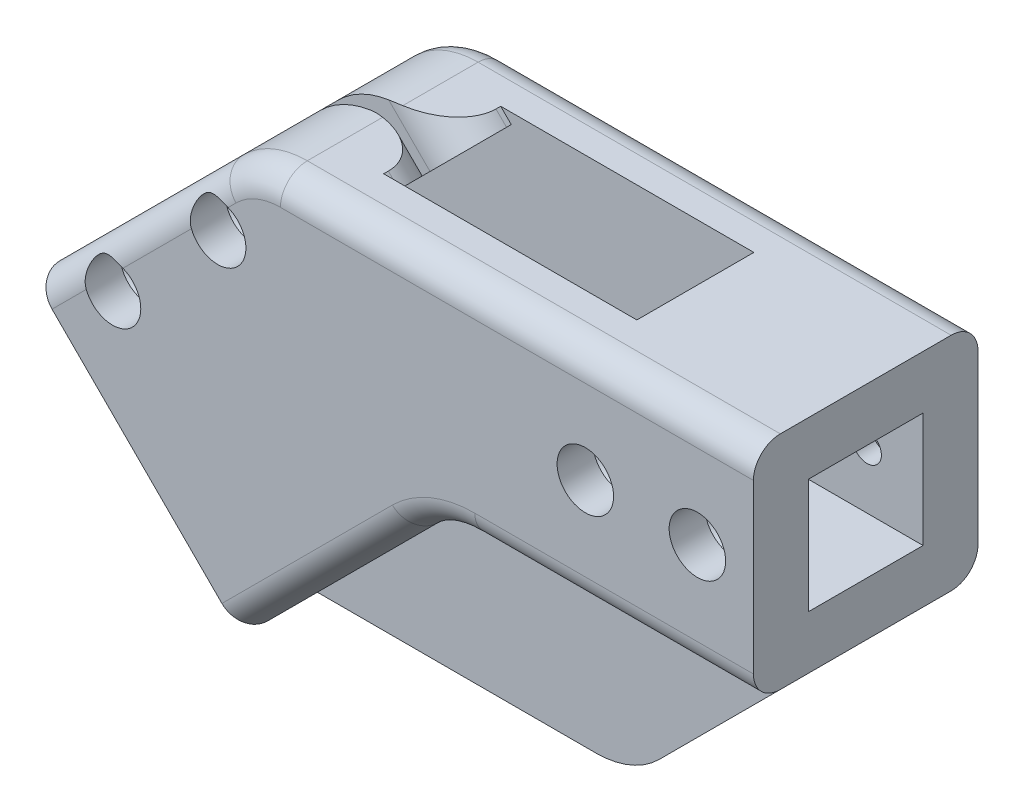
from build123d import *

# Parameters (mm, degrees)
BOSS_EXTRUDE1_DEPTH                            = 6.525
BOSS_EXTRUDE1_2_DEPTH                          = 6.525
BOSS_EXTRUDE1_3_DEPTH                          = 6.525
BOSS_EXTRUDE2_START                            = 6.525
BOSS_EXTRUDE2_DEPTH                            = 6
BOSS_EXTRUDE3_DEPTH                            = 4
FILLET1_R                                      = 10
FILLET2_R                                      = 3
CUT_EXTRUDE1_DEPTH                             = 1
CSK_FOR_M3_FLAT_HEAD_MACHINE_SCREW1_AT_2_COUNT = 2
CSK_FOR_M3_FLAT_HEAD_MACHINE_SCREW1_AT_2_PITCH = 16.585281374
CSK_FOR_M3_FLAT_HEAD_MACHINE_SCREW1_AT_3_COUNT = 2
CSK_FOR_M3_FLAT_HEAD_MACHINE_SCREW1_AT_3_PITCH = 41.156976568
CSK_FOR_M3_FLAT_HEAD_MACHINE_SCREW1_AT_4_COUNT = 2
CSK_FOR_M3_FLAT_HEAD_MACHINE_SCREW1_AT_4_PITCH = 53.622609719
CUT_EXTRUDE2_DEPTH                             = 4
FILLET3_R                                      = 5
MOVE_START                                     = -6.525
MOVE_FACE2_OUTLINE_R                           = 1.6
MOVE_FACE2_DEPTH                               = 0.125
MOVE_START_2                                   = 6.4
MOVE_FACE2_2_OUTLINE_R                         = 1.6
MOVE_FACE2_2_DEPTH                             = 0.125
MOVE_START_3                                   = -0.05
MOVE_FACE3_OUTLINE_W                           = 37.75
MOVE_FACE3_OUTLINE_H                           = 12.8
MOVE_FACE3_DEPTH                               = 12.8


with BuildPart() as part:
    # Sketch1 → Boss-Extrude1 (new body)
    with BuildSketch(Plane.XY):
        Polygon((25, 0), (-12.7, 0), (-36.405591591, -23.705591591), (-32.162950904, -27.948232278), (-10.214718626, -6), (25, -6), align=None)
    boss_extrude1 = extrude(amount=BOSS_EXTRUDE1_DEPTH)



with BuildPart() as body_2:
    # Sketch1 → Boss-Extrude1 2 (new body)
    with BuildSketch(Plane.XY):
        Polygon((-49.345645687, -10.765537495), (-21.061374439, 17.518733752), (-22.242640687, 18.7), (-31.900923472, 18.7), (-55.356053327, -4.755129855), align=None)
    boss_extrude1_2 = extrude(amount=BOSS_EXTRUDE1_2_DEPTH)


with BuildPart() as body_3:
    # Sketch1 → Boss-Extrude1 3 (new body)
    with BuildSketch(Plane.XY):
        Polygon((6, 18.7), (0, 12.7), (25, 12.7), (25, 18.7), align=None)
    boss_extrude1_3 = extrude(amount=BOSS_EXTRUDE1_3_DEPTH)


with BuildPart() as part_1:
    add(part.part)

    add(body_2.part)  # Boss-Extrude2 merges body 2

    add(body_3.part)  # Boss-Extrude2 merges body 3
    # Sketch1<3> → Boss-Extrude2 (add)
    with BuildSketch(Plane.XY.offset(BOSS_EXTRUDE2_START)):
        Polygon((-32.162950904, -27.948232278), (-10.214718626, -6), (25, -6), (25, 18.7), (-31.900923472, 18.7), (-55.356053327, -4.755129855), align=None)
    boss_extrude2 = extrude(amount=BOSS_EXTRUDE2_DEPTH)

    # Mirror2: Boss-Extrude1, Boss-Extrude1 2, Boss-Extrude1 3, Boss-Extrude2 across plane
    add(boss_extrude1.mirror(Plane.XY))
    add(boss_extrude1_2.mirror(Plane.XY))
    add(boss_extrude1_3.mirror(Plane.XY))
    add(boss_extrude2.mirror(Plane.XY))

    # Sketch2 → Boss-Extrude3 (add, symmetric)
    with BuildSketch(Plane.XY):
        Polygon((-32.162950904, -27.948232278), (3.051767722, -27.948232278), (25, -6), (-10.214718626, -6), align=None)
    extrude(amount=BOSS_EXTRUDE3_DEPTH, both=True)

    # Fillet1
    fillet1_edges = [part_1.edges().sort_by_distance(p)[0] for p in [
        (-31.900923472, 18.7, 0),
        (-10.214718626, -6, 8.2625),
        (-10.214718626, -6, -8.2625),
        (3.051767722, -27.948232278, 0),
    ]]
    fillet(fillet1_edges, radius=FILLET1_R)

    # Fillet2
    fillet2_edges = [part_1.edges().sort_by_distance(p)[0] for p in [
        (-22.653300859, -18.438582233, -12.525),
        (-22.653300859, -18.438582233, 12.525),
        (-45.092954493, 5.507968978, -12.525),
        (-45.092954493, 5.507968978, 12.525),
        (-31.585622172, 17.938795325, -12.525),
        (-31.585622172, 17.938795325, 12.525),
        (-9.899417326, -6.761204675, -12.525),
        (-9.899417326, -6.761204675, 12.525),
        (9.463708499, -6, 12.525),
        (-1.379393924, 18.7, 12.525),
        (-1.379393924, 18.7, -12.525),
        (9.463708499, -6, -12.525),
    ]]
    fillet(fillet2_edges, radius=FILLET2_R)

    # Sketch1<4> → Cut-Extrude1 (cut, symmetric)
    with BuildSketch(Plane.XY):
        Polygon((-49.345645687, -10.765537495), (-21.061374439, 17.518733752), (-22.242640687, 18.7), (-31.900923472, 18.7), (-55.356053327, -4.755129855), align=None)
    extrude(amount=CUT_EXTRUDE1_DEPTH, both=True, mode=Mode.SUBTRACT)

    # Sketch6 → CSK for M3 Flat Head Machine Screw1 (revolve, cut)
    with BuildSketch(Plane(origin=(-34.759502115, 9.831013716, 12.525), x_dir=(0, -1, 0), z_dir=(1, 0, 0))):
        Polygon((0, 0), (0, 25.05), (1.6, 25.05), (1.6, 5.55), (3.15, 4), (3.15, 0), align=None)
    csk_for_m3_flat_head_machine_screw1 = revolve(axis=Axis((-34.759502115, 9.831013716, 18.875), (0, 0, -1)), mode=Mode.SUBTRACT)

    # CSK for M3 Flat Head Machine Screw1 at 2: CSK for M3 Flat Head Machine Screw1 ×2
    with Locations(*[Vector(-0.7071067811865509, -0.7071067811865441, 0) * (i * CSK_FOR_M3_FLAT_HEAD_MACHINE_SCREW1_AT_2_PITCH) for i in range(1, CSK_FOR_M3_FLAT_HEAD_MACHINE_SCREW1_AT_2_COUNT)]):
        add(csk_for_m3_flat_head_machine_screw1, mode=Mode.SUBTRACT)

    # CSK for M3 Flat Head Machine Screw1 at 3: CSK for M3 Flat Head Machine Screw1 ×2
    with Locations(*[Vector(0.9964167811823362, -0.08457894642422821, 0) * (i * CSK_FOR_M3_FLAT_HEAD_MACHINE_SCREW1_AT_3_PITCH) for i in range(1, CSK_FOR_M3_FLAT_HEAD_MACHINE_SCREW1_AT_3_COUNT)]):
        add(csk_for_m3_flat_head_machine_screw1, mode=Mode.SUBTRACT)

    # CSK for M3 Flat Head Machine Screw1 at 4: CSK for M3 Flat Head Machine Screw1 ×2
    with Locations(*[Vector(0.9978906732683498, -0.06491690229855007, 0) * (i * CSK_FOR_M3_FLAT_HEAD_MACHINE_SCREW1_AT_4_PITCH) for i in range(1, CSK_FOR_M3_FLAT_HEAD_MACHINE_SCREW1_AT_4_COUNT)]):
        add(csk_for_m3_flat_head_machine_screw1, mode=Mode.SUBTRACT)

    # Sketch7 → Cut-Extrude2 (cut)
    with BuildSketch(Plane(origin=(0, 0, -12.525), x_dir=(-1, 0, 0), z_dir=(0, 0, -1))):
        Polygon((37.93826407, 10.682760415), (35.611248814, 13.00977567), (32.43248686, 12.158028972), (31.580740161, 8.979267018), (33.907755417, 6.652251762), (37.086517371, 7.503998461), align=None)
        Polygon((49.665828997, -1.044804513), (47.338813742, 1.282210743), (44.160051787, 0.430464044), (43.308305089, -2.74829791), (45.635320344, -5.075313166), (48.814082299, -4.223566467), align=None)
        Polygon((-15.459103466, 6.35), (-17.104551733, 9.2), (-20.395448267, 9.2), (-22.040896534, 6.35), (-20.395448267, 3.5), (-17.104551733, 3.5), align=None)
        Polygon((-2.959103466, 6.35), (-4.604551733, 9.2), (-7.895448267, 9.2), (-9.540896534, 6.35), (-7.895448267, 3.5), (-4.604551733, 3.5), align=None)
    extrude(amount=-CUT_EXTRUDE2_DEPTH, mode=Mode.SUBTRACT)

    # Fillet3
    fillet3_edges = [part_1.edges().sort_by_distance(p)[0] for p in [
        (-21.652007563, 18.109366876, -1),
        (-52.350849507, -7.760333675, 1),
        (-52.350849507, -7.760333675, -1),
        (-21.652007563, 18.109366876, 1),
    ]]
    fillet(fillet3_edges, radius=FILLET3_R)

    # Move Face2: read off the stored shape, not the designer's step
    # Move Face2 outline → Move Face2 (add)
    with BuildSketch(Plane.XY.offset(MOVE_START)):
        Polygon((-12.7, 0), (25, 0), (25, 12.7), (0, 12.7), align=None)
        with Locations((6.25, 6.35)):
            Circle(MOVE_FACE2_OUTLINE_R, mode=Mode.SUBTRACT)
        with Locations((18.75, 6.35)):
            Circle(MOVE_FACE2_OUTLINE_R, mode=Mode.SUBTRACT)
    extrude(amount=MOVE_FACE2_DEPTH)

    # Move Face2 2 outline → Move Face2 2 (add)
    with BuildSketch(Plane.XY.offset(MOVE_START_2)):
        Polygon((-12.7, 0), (25, 0), (25, 12.7), (0, 12.7), align=None)
        with Locations((6.25, 6.35)):
            Circle(MOVE_FACE2_2_OUTLINE_R, mode=Mode.SUBTRACT)
        with Locations((18.75, 6.35)):
            Circle(MOVE_FACE2_2_OUTLINE_R, mode=Mode.SUBTRACT)
    extrude(amount=MOVE_FACE2_2_DEPTH)

    # Move Face3: read off the stored shape, not the designer's step
    # Move Face3 outline → Move Face3 (cut)
    with BuildSketch(Plane(origin=(0, 0, 0), x_dir=(1, 0, 0), z_dir=(0, 1, 0)).offset(MOVE_START_3)):
        with Locations((6.125, 0)):
            Rectangle(MOVE_FACE3_OUTLINE_W, MOVE_FACE3_OUTLINE_H)
    extrude(amount=MOVE_FACE3_DEPTH, mode=Mode.SUBTRACT)


solid = part_1.part
